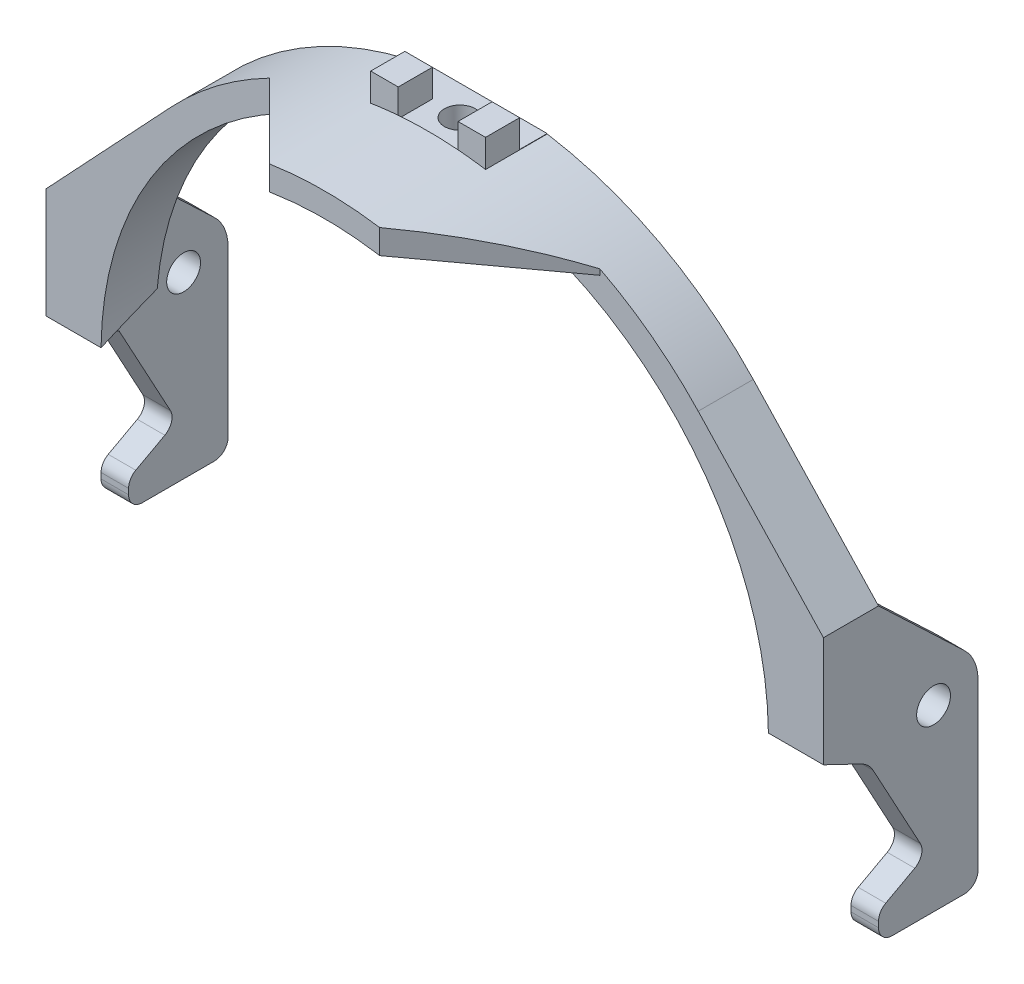
from build123d import *

# Parameters (mm, degrees)
BOSS_EXTRUDE1_DEPTH                 = 6.35
SKETCH2_R                           = 1.9526
BOSS_EXTRUDE2_DEPTH                 = 3.175
CUT_EXTRUDE1_DEPTH                  = 3.175158
CUT_EXTRUDE1_DIRECTION_2_REACH      = 95.876
CUT_EXTRUDE1_DIRECTION_2_END_RADIUS = 38.494186542
BOSS_EXTRUDE3_DEPTH                 = 12.7
CHAMFER2_SIZE                       = 12.7
F_9_64_0_14063_DIAMETER_HOLE1_D     = 3.572002
CUT_EXTRUDE4_DEPTH                  = 7.112
BOSS_EXTRUDE4_DEPTH                 = 3.175
BOSS_EXTRUDE4_DEPTH_BACK            = 1.5875
SKETCH12_W                          = 3.175
SKETCH12_H                          = 7.112
BOSS_EXTRUDE6_START                 = -89.684533
BOSS_EXTRUDE6_DEPTH                 = 89.684533
FILLET5_R                           = 3.175
SKETCH18_W                          = 83.334533228
SKETCH18_H                          = 26.913353796
CUT_EXTRUDE8_DEPTH                  = 71.073899328
CUT_EXTRUDE6_DEPTH                  = 71.563193649
CUT_EXTRUDE6_DEPTH_BACK             = 71.563193649
SKETCH15_W                          = 3.175
SKETCH15_H                          = 3.175
FILLET6_R                           = 1.5875


with BuildPart() as part:
    # Sketch1 → Boss-Extrude1 (new body)
    with BuildSketch(Plane.XY):
        with BuildLine():
            Line((44.842266614, 13.1), (30.393088537, 28.505811271))
            ThreePointArc((30.393088537, 28.505811271), (0, 41.669186542), (-30.393088537, 28.505811271))
            Line((-30.393088537, 28.505811271), (-44.842266614, 13.1))
            Line((-44.842266614, 13.1), (-44.842266614, 0.4))
            Line((-44.842266614, 0.4), (-41.667266614, 0.4))
            Line((-41.667266614, 0.4), (-38.49210825, 0.4))
            ThreePointArc((-38.49210825, 0.4), (0, 38.494186542), (38.49210825, 0.4))
            Line((38.49210825, 0.4), (41.667266614, 0.4))
            Line((41.667266614, 0.4), (44.842266614, 0.4))
            Line((44.842266614, 0.4), (44.842266614, 13.1))
        make_face()
    extrude(amount=BOSS_EXTRUDE1_DEPTH)

    # Sketch2 → Boss-Extrude2 (add)
    with BuildSketch(Plane(origin=(44.842266614, 0, 0), x_dir=(0, 0, -1), z_dir=(1, 0, 0))):
        with BuildLine():
            Line((0, 13.1), (9.880631277, 3.71845728))
            ThreePointArc((9.880631277, 3.71845728), (10.572747241, -2.908726095), (4.134101417, -4.624075608))
            Line((4.134101417, -4.624075608), (-6.35, 0.4))
            Line((-6.35, 0.4), (0, 0.4))
            Line((0, 0.4), (0, 13.1))
        make_face()
        with Locations((6.35, 0)):
            Circle(SKETCH2_R, mode=Mode.SUBTRACT)
    boss_extrude2 = extrude(amount=-BOSS_EXTRUDE2_DEPTH)

    # Mirror1: Boss-Extrude2 across plane
    add(boss_extrude2.mirror(Plane(origin=(0, 0, 0), x_dir=(0, 0, 1), z_dir=(1, 0, 0))))

    # Sketch4 → Cut-Extrude1 (cut)
    with BuildSketch(Plane(origin=(-38.49210825, 0, 0), x_dir=(0, 0, -1), z_dir=(1, 0, 0))):
        Polygon((-6.35, 0.4), (0, 3.194), (0, 0.4), align=None)
    extrude(amount=-CUT_EXTRUDE1_DEPTH, mode=Mode.SUBTRACT)

    # Cut-Extrude1 direction 2: up to this cylinder (the profile starts outside it)
    cut_extrude1_direction_2_end = Plane(origin=(0, 0, 2.116667), z_dir=(0, 0, -1)) * Cylinder(CUT_EXTRUDE1_DIRECTION_2_END_RADIUS, 269.740373084, mode=Mode.PRIVATE)
    # Sketch4 → Cut-Extrude1 direction 2 (cut, up to the surface)
    with BuildSketch(Plane(origin=(-38.49210825, 0, 0), x_dir=(0, 0, -1), z_dir=(1, 0, 0)), mode=Mode.PRIVATE) as cut_extrude1_direction_2_sk1:
        Polygon((-6.35, 0.4), (0, 3.194), (0, 0.4), align=None)
    cut_extrude1_direction_2_tool1 = extrude(cut_extrude1_direction_2_sk1.sketch, amount=CUT_EXTRUDE1_DIRECTION_2_REACH, mode=Mode.PRIVATE) - cut_extrude1_direction_2_end
    add(cut_extrude1_direction_2_tool1.solids().sort_by_distance((-38.492108, 1.331333, 2.116667))[0], mode=Mode.SUBTRACT)

    # Sketch5 → Boss-Extrude3 (add)
    with BuildSketch(Plane.XY.offset(6.35)):
        with BuildLine():
            Line((-6.35, 38.374458705), (-6.35, 41.182503652))
            ThreePointArc((-6.35, 41.182503652), (0, 41.669186542), (6.35, 41.182503652))
            Line((6.35, 41.182503652), (6.35, 38.374458705))
            Line((6.35, 38.374458705), (5.95, 38.43637921))
            ThreePointArc((5.95, 38.43637921), (0, 38.894186542), (-5.95, 38.43637921))
            Line((-5.95, 38.43637921), (-6.35, 38.374458705))
        make_face()
    extrude(amount=BOSS_EXTRUDE3_DEPTH)

    # Chamfer2
    # the kernel refuses this chamfer: 12.7 mm, written as the material it adds along each edge
    with BuildSketch(Plane(origin=(6.35, 73.842877599, 6.35), x_dir=(0.9996219169112968, 0, -0.02749587661058633), z_dir=(0, -1, 0))) as chamfer2_piece_1_section:
        Polygon((CHAMFER2_SIZE * 0.999621916911, CHAMFER2_SIZE * 0.0274958766106), (-CHAMFER2_SIZE * 0.0274958766106, CHAMFER2_SIZE * 0.999621916911), (0, 0), align=None)
    chamfer2_piece_1 = extrude(amount=68.128792841, mode=Mode.PRIVATE)
    chamfer2_piece_1 = chamfer2_piece_1 & Plane(origin=(0, 0, 10.815604597), x_dir=(0.7293900135753609, 0.6840980982991656, 0), z_dir=(0, 0, -1)) * Cylinder(41.669186542, 188, mode=Mode.PRIVATE)
    chamfer2_piece_1 = split(chamfer2_piece_1, bisect_by=Plane(origin=(9.796586026, 37.840922839, 10.815604597), z_dir=(0.15297916035843936, 0.988229414911349, 0)), keep=Keep.TOP, mode=Mode.PRIVATE)
    chamfer2_piece_1 = split(chamfer2_piece_1, bisect_by=Plane(origin=(9.988062905, 39.077843499, 19.05), z_dir=(0, 0, -1)), keep=Keep.TOP, mode=Mode.PRIVATE)
    add(chamfer2_piece_1)
    with BuildSketch(Plane(origin=(-6.35, 5.714084758, 6.35), x_dir=(-0.9996219169112966, 0, -0.0274958766105864), z_dir=(0, 1, 0))) as chamfer2_piece_2_section:
        Polygon((CHAMFER2_SIZE * 0.999621916911, CHAMFER2_SIZE * 0.0274958766106), (-CHAMFER2_SIZE * 0.0274958766106, CHAMFER2_SIZE * 0.999621916911), (0, 0), align=None)
    chamfer2_piece_2 = extrude(amount=68.128792841, mode=Mode.PRIVATE)
    chamfer2_piece_2 = chamfer2_piece_2 & Plane(origin=(0, 0, 10.81560458), x_dir=(0.7293900135753609, 0.6840980982991656, 0), z_dir=(0, 0, -1)) * Cylinder(41.669186542, 188, mode=Mode.PRIVATE)
    chamfer2_piece_2 = split(chamfer2_piece_2, bisect_by=Plane(origin=(-9.796586033, 37.840922838, 10.81560458), z_dir=(-0.15297916035843936, 0.988229414911349, 0)), keep=Keep.TOP, mode=Mode.PRIVATE)
    chamfer2_piece_2 = split(chamfer2_piece_2, bisect_by=Plane(origin=(-9.988062912, 39.077843496, 19.05), z_dir=(0, 0, -1)), keep=Keep.TOP, mode=Mode.PRIVATE)
    add(chamfer2_piece_2)

    # 9/64 (0.14063) Diameter Hole1 (through all)
    with Locations(Plane(origin=(0, 41.669186542, 0), x_dir=(1, 0, 0), z_dir=(0, 1, 0))):
        with Locations((0, -3.44678)):
            Hole(F_9_64_0_14063_DIAMETER_HOLE1_D / 2)

    # Sketch11 → Cut-Extrude4 (cut)
    with BuildSketch(Plane(origin=(0, 0, 0), x_dir=(-1, 0, 0), z_dir=(0, 0, -1))):
        with BuildLine():
            ThreePointArc((6.35, 41.182503652), (0, 41.669186542), (-6.35, 41.182503652))
            Line((-6.35, 41.182503652), (6.35, 41.182503652))
        make_face()
    extrude(amount=-CUT_EXTRUDE4_DEPTH, mode=Mode.SUBTRACT)

    # Sketch12 → Boss-Extrude4 (add, two sides: drawn at the far end of the back side and taken through both)
    with BuildSketch(Plane(origin=(0, 41.182503652, 0), x_dir=(1, 0, 0), z_dir=(0, 1, 0)).offset(-BOSS_EXTRUDE4_DEPTH_BACK)):
        with Locations((-5.0355, -3.556)):
            Rectangle(SKETCH12_W, SKETCH12_H)
        with Locations((5.0355, -3.556)):
            Rectangle(SKETCH12_W, SKETCH12_H)
    extrude(amount=BOSS_EXTRUDE4_DEPTH + BOSS_EXTRUDE4_DEPTH_BACK)

    # Sketch16 → Boss-Extrude6 (add)
    with BuildSketch(Plane(origin=(44.842266614, 0, 0), x_dir=(0, 0, -1), z_dir=(1, 0, 0)).offset(BOSS_EXTRUDE6_START)):
        with BuildLine():
            Line((-1.107949291, -2.112037804), (5.579304246, -14.434735992))
            Line((5.579304246, -14.434735992), (0, -17.4625))
            Line((0, -17.4625), (0, -20.6375))
            Line((0, -20.6375), (9.8901, -20.6375))
            ThreePointArc((9.8901, -20.6375), (11.012632015, -20.172532015), (11.4776, -19.05))
            Line((11.4776, -19.05), (11.4776, 0))
            ThreePointArc((11.4776, 0), (9.082218896, -4.339039256), (4.134101417, -4.624075608))
            Line((4.134101417, -4.624075608), (-1.107949291, -2.112037804))
        make_face()
    boss_extrude6 = extrude(amount=BOSS_EXTRUDE6_DEPTH)

    # Fillet5
    fillet5_edges = [part.edges().sort_by_distance(p)[0] for p in [
        (43.254766614, -2.112037804, 1.107949291),
    ]]
    fillet(fillet5_edges, radius=FILLET5_R)

    # Mirror4: Boss-Extrude6 across plane
    add(boss_extrude6.mirror(Plane(origin=(0, 0, 0), x_dir=(0, 0, 1), z_dir=(1, 0, 0))))

    # Sketch18 → Cut-Extrude8 (cut, through all)
    with BuildSketch(Plane(origin=(0, 0, -11.4776), x_dir=(-1, 0, 0), z_dir=(0, 0, -1))):
        with Locations((0, -13.456676898)):
            Rectangle(SKETCH18_W, SKETCH18_H)
    extrude(amount=-CUT_EXTRUDE8_DEPTH, mode=Mode.SUBTRACT)

    # Sketch15 → Cut-Extrude6 (cut, two sides: drawn at the far end of the back side and taken through both)
    with BuildSketch(Plane(origin=(6.623, 0, 0), x_dir=(0, 0, -1), z_dir=(1, 0, 0)).offset(-CUT_EXTRUDE6_DEPTH_BACK)):
        with Locations((-1.5875, 42.770003652)):
            Rectangle(SKETCH15_W, SKETCH15_H)
    extrude(amount=CUT_EXTRUDE6_DEPTH + CUT_EXTRUDE6_DEPTH_BACK, mode=Mode.SUBTRACT)

    # Fillet6
    fillet6_edges = [part.edges().sort_by_distance(p)[0] for p in [
        (-43.2547665, -20.6375, 0),
        (-43.2547665, -17.4625, 0),
        (-43.2547665, -14.434735992, -5.579304246),
        (43.254766614, -14.434735992, -5.579304246),
        (43.254766614, -17.4625, 0),
        (43.254766614, -20.6375, 0),
    ]]
    fillet(fillet6_edges, radius=FILLET6_R)


solid = part.part
